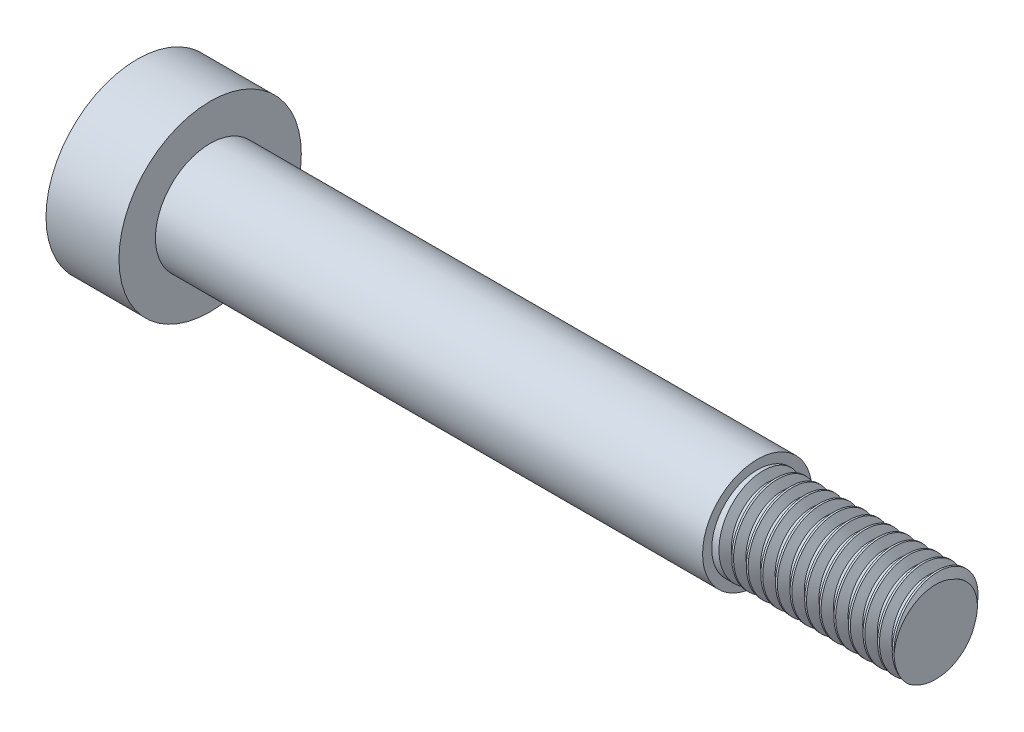
from build123d import *

# Parameters (mm, degrees)
CUT_EXTRUDE_1_DEPTH = 2.5
THREAD_1_PITCH      = 0.8


with BuildPart() as part:
    # Sketch 1 → 旋转1 (revolve)
    with BuildSketch(Plane.XY, mode=Mode.PRIVATE) as revolve_1_sk:
        Polygon((0, 0), (44, 0), (44, 2.5), (34, 2.5), (34, 3), (4, 3), (4, 5), (0, 5), align=None)
    revolve(revolve_1_sk.sketch.rotate(Axis((-10.95415464, 0, 0), (1, 0, 0)), 90), axis=Axis((-10.95415464, 0, 0), (1, 0, 0)))

    # 草图2 → 切除-拉伸1 (cut)
    with BuildSketch(Plane.ZY):
        Polygon((0, 1.732050808), (-1.5, 0.866025404), (-1.5, -0.866025404), (0, -1.732050808), (1.5, -0.866025404), (1.5, 0.866025404), align=None)
    extrude(amount=-CUT_EXTRUDE_1_DEPTH, mode=Mode.SUBTRACT)

    # 螺纹线1: the profile of Sketch 1 2 profile screwed along a right-hand helix of 12.5 turns, 8 arcs to a turn; built about Z, then put on its axis
    thread_1_z = Axis((0, 0, 0), (0, 0, 1))
    thread_1_corners = [(2.5003, 0, -0.000173205), (2.5003, 0, 0.700173203), (2.0669873, 0, 0.449999999), (2.0669873, 0, 0.249999999)]
    with BuildLine(mode=Mode.PRIVATE) as thread_1_profile:
        Line(thread_1_corners[0], thread_1_corners[1])
        Line(thread_1_corners[1], thread_1_corners[2])
        Line(thread_1_corners[2], thread_1_corners[3])
        Line(thread_1_corners[3], thread_1_corners[0])
    thread_1_cap = Face(thread_1_profile.wire())
    thread_1_turn_angles = [0, 22.5, 45, 67.5, 90, 112.5, 135, 157.5, 180, 202.5, 225, 247.5, 270, 292.5, 315, 337.5, 360]
    thread_1_turn_weights = [1, 0.9238795325112867, 1, 0.9238795325112867, 1, 0.9238795325112867, 1, 0.9238795325112867, 1, 0.9238795325112867, 1, 0.9238795325112867, 1, 0.9238795325112867, 1, 0.9238795325112867, 1]
    thread_1_turn_rails = [Edge.make_bspline([Vector(p[0], p[1], 0).rotate(thread_1_z, thread_1_turn_angles[k]) / thread_1_turn_weights[k] + Vector(0, 0, p[2] + THREAD_1_PITCH * thread_1_turn_angles[k] / 360) for k in range(17)], [0, 0, 0, 1, 1, 2, 2, 3, 3, 4, 4, 5, 5, 6, 6, 7, 7, 8, 8, 8], 2, thread_1_turn_weights) for p in thread_1_corners]
    thread_1_turn_sides = [Face.make_surface_from_curves(thread_1_turn_rails[p[0]], thread_1_turn_rails[p[1]]) for p in [(0, 1), (1, 2), (2, 3), (3, 0)]]
    thread_1_last_angles = [4320, 4342.5, 4365, 4387.5, 4410, 4432.5, 4455, 4477.5, 4500]
    thread_1_last_weights = [1, 0.9238795325112867, 1, 0.9238795325112867, 1, 0.9238795325112867, 1, 0.9238795325112867, 1]
    thread_1_last_rails = [Edge.make_bspline([Vector(p[0], p[1], 0).rotate(thread_1_z, thread_1_last_angles[k]) / thread_1_last_weights[k] + Vector(0, 0, p[2] + THREAD_1_PITCH * thread_1_last_angles[k] / 360) for k in range(9)], [0, 0, 0, 1, 1, 2, 2, 3, 3, 4, 4, 4], 2, thread_1_last_weights) for p in thread_1_corners]
    thread_1_last_sides = [Face.make_surface_from_curves(thread_1_last_rails[p[0]], thread_1_last_rails[p[1]]) for p in [(0, 1), (1, 2), (2, 3), (3, 0)]]
    thread_1 = Plane(origin=(34, 0, 0), x_dir=(0, 0, -1), z_dir=(1, 0, 0)) * Solid(Shell([*[p.moved(Location((0, 0, THREAD_1_PITCH * i))) for i in range(12) for p in thread_1_turn_sides], *thread_1_last_sides, thread_1_cap, thread_1_cap.rotate(thread_1_z, 4500).moved(Location((0, 0, THREAD_1_PITCH * 4500 / 360)))]))
    add(thread_1, mode=Mode.SUBTRACT)


solid = part.part
